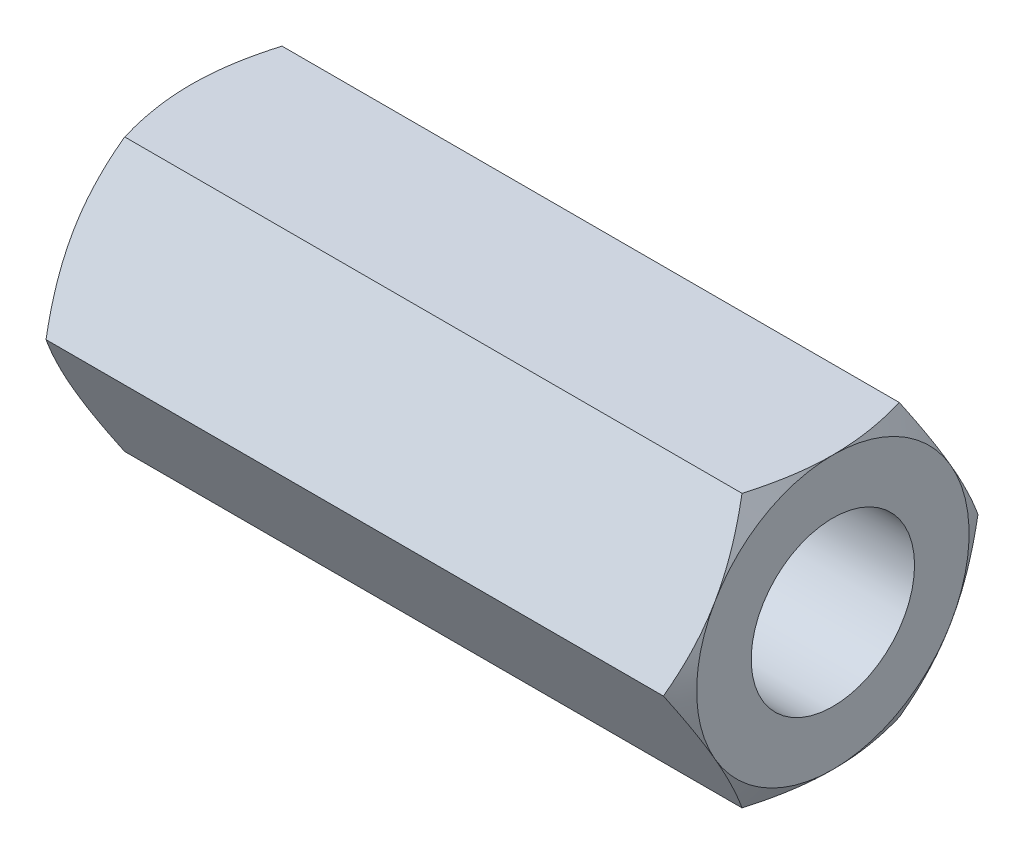
from build123d import *

# Parameters (mm, degrees)
SKETCH1_R      = 1.4
EXTRUDE1_DEPTH = 5.5


# Read off the part's stored shape, not the designer's step: Cut-Extrude1
with BuildPart() as part:
    # Sketch1 → Extrude1 (new, symmetric)
    with BuildSketch(Plane(origin=(0, 0, 0), x_dir=(0, 0, -1), z_dir=(1, 0, 0))):
        Polygon((2.696225757, 0), (1.348112879, 2.335), (-1.348112879, 2.335), (-2.696225757, 0), (-1.348112879, -2.335), (1.348112879, -2.335), align=None)
        Circle(SKETCH1_R, mode=Mode.SUBTRACT)
    extrude(amount=EXTRUDE1_DEPTH, both=True)

    # Cut-Extrude1 outline → Cut-Extrude1 (revolve, cut)
    with BuildSketch(Plane.YX):
        Polygon((2.696225758, 5.5), (2.335, 5.5), (2.696225751, 5.291446215), align=None)
    cut_extrude1 = revolve(axis=Axis((0, 0, 0), (1, 0, 0)), mode=Mode.SUBTRACT)

    # Mirror1: Cut-Extrude1 across plane
    add(cut_extrude1.mirror(Plane(origin=(0, 0, 0), x_dir=(0, 0, 1), z_dir=(1, 0, 0))), mode=Mode.SUBTRACT)


solid = part.part
